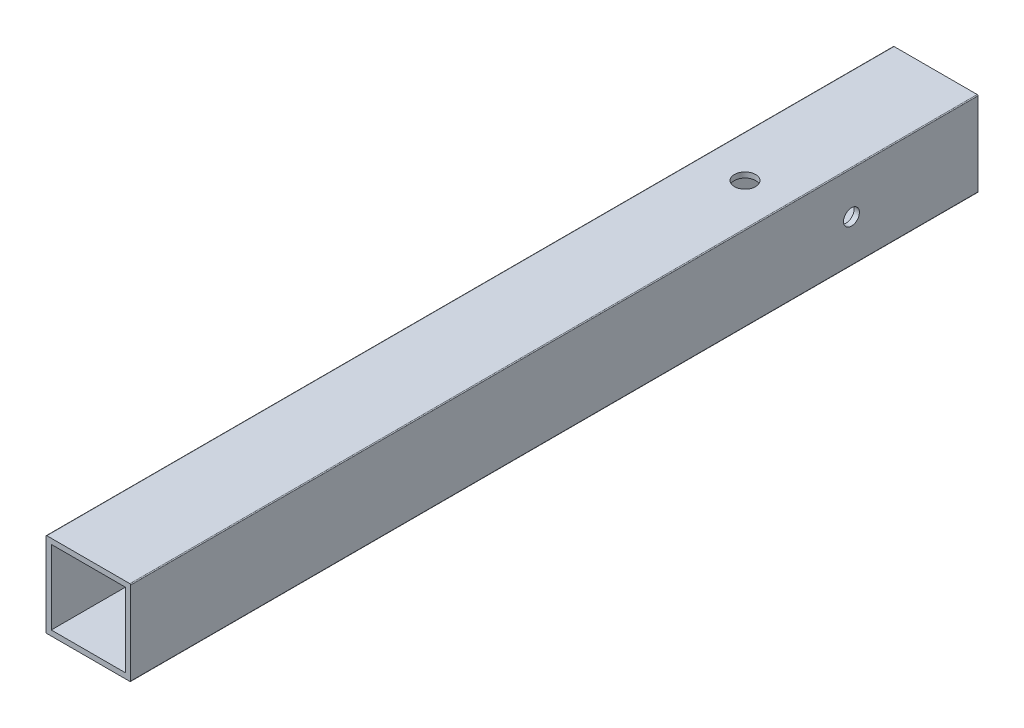
from build123d import *

# Parameters (mm, degrees)
SKETCH1_W           = 22.225
SKETCH1_H           = 22.225
BOSS_EXTRUDE1_DEPTH = 254
SKETCH4_R           = 2.38125
CUT_EXTRUDE2_DEPTH  = 257.375106351
SKETCH5_R           = 3.175
CUT_EXTRUDE3_DEPTH  = 50.8


with BuildPart() as part:
    # Sketch1 → Boss-Extrude1 (new body)
    with BuildSketch(Plane(origin=(0, 0, 0), x_dir=(-1, 0, 0), z_dir=(0, 0, -1))):
        with BuildLine():
            Line((1.5875, -1.3335), (1.5875, 23.5585))
            ThreePointArc((1.5875, 23.5585), (1.513105122, 23.738105122), (1.3335, 23.8125))
            Line((1.3335, 23.8125), (-23.5585, 23.8125))
            ThreePointArc((-23.5585, 23.8125), (-23.738105122, 23.738105122), (-23.8125, 23.5585))
            Line((-23.8125, 23.5585), (-23.8125, -1.3335))
            ThreePointArc((-23.8125, -1.3335), (-23.738105122, -1.513105122), (-23.5585, -1.5875))
            Line((-23.5585, -1.5875), (1.3335, -1.5875))
            ThreePointArc((1.3335, -1.5875), (1.513105122, -1.513105122), (1.5875, -1.3335))
        make_face()
        with Locations((-11.1125, 11.1125)):
            Rectangle(SKETCH1_W, SKETCH1_H, mode=Mode.SUBTRACT)
    extrude(amount=-BOSS_EXTRUDE1_DEPTH)

    # Sketch4 → Cut-Extrude2 (cut, through all)
    with BuildSketch(Plane(origin=(23.8125, 0, 0), x_dir=(0, 0, -1), z_dir=(1, 0, 0))):
        with Locations((-37.933268304, 11.1125)):
            Circle(SKETCH4_R)
    extrude(amount=-CUT_EXTRUDE2_DEPTH, mode=Mode.SUBTRACT)

    # Sketch5 → Cut-Extrude3 (cut)
    with BuildSketch(Plane(origin=(0, 23.8125, 0), x_dir=(1, 0, 0), z_dir=(0, 1, 0))):
        with Locations((11.1125, -57.15)):
            Circle(SKETCH5_R)
    extrude(amount=-CUT_EXTRUDE3_DEPTH, mode=Mode.SUBTRACT)


solid = part.part
